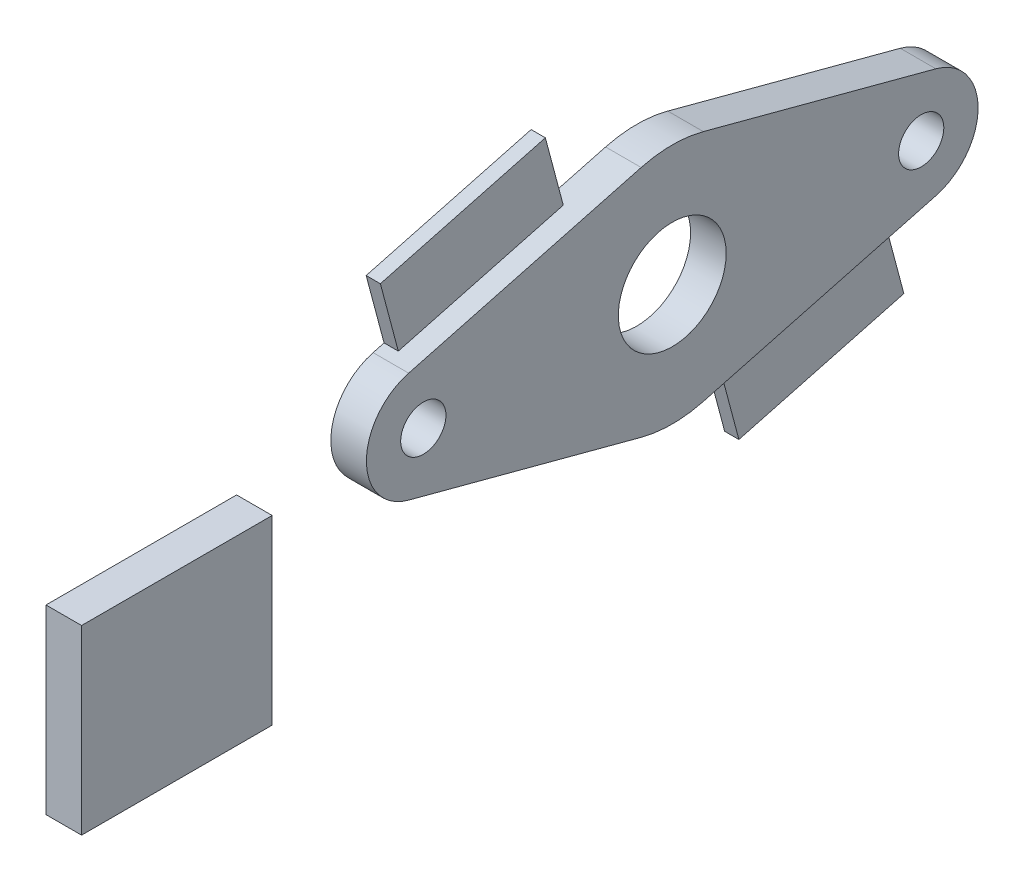
from build123d import *

# Parameters (mm, degrees)
SKETCH1_R           = 2.0193
SKETCH1_R_2         = 4.8133
BASE_FLANGE1_DEPTH  = 3.175
SKETCH2_W           = 17.015394269
SKETCH2_H           = 16.210936875
BOSS_EXTRUDE1_DEPTH = 3.175
BOSS_EXTRUDE2_DEPTH = 1.27


# Sheet-metal steps are written as plain solids
with BuildPart() as part:
    # Sketch1 → Base-Flange1 (new body)
    with BuildSketch(Plane(origin=(0, 0, 0), x_dir=(0, 0, -1), z_dir=(1, 0, 0))):
        with BuildLine():
            Line((-23.531285714, 4.909176879), (-2.775857143, 10.432000869))
            ThreePointArc((-2.775857143, 10.432000869), (0, 10.795), (2.775857143, 10.432000869))
            Line((2.775857143, 10.432000869), (23.531285714, 4.909176879))
            ThreePointArc((23.531285714, 4.909176879), (27.305, 0), (23.531285714, -4.909176879))
            Line((23.531285714, -4.909176879), (2.775857143, -10.432000869))
            ThreePointArc((2.775857143, -10.432000869), (0, -10.795), (-2.775857143, -10.432000869))
            Line((-2.775857143, -10.432000869), (-23.531285714, -4.909176879))
            ThreePointArc((-23.531285714, -4.909176879), (-27.305, 0), (-23.531285714, 4.909176879))
        make_face()
        with Locations((-22.225, 0)):
            Circle(SKETCH1_R, mode=Mode.SUBTRACT)
        with Locations((22.225, 0)):
            Circle(SKETCH1_R, mode=Mode.SUBTRACT)
        Circle(SKETCH1_R_2, mode=Mode.SUBTRACT)
    extrude(amount=-BASE_FLANGE1_DEPTH)

    # Sketch6 → Boss-Extrude2 (add)
    with BuildSketch(Plane.ZY.offset(3.175)):
        Polygon((-5.91907135, -9.595621183), (-20.646601988, -5.67676404), (-22.581830021, -12.949580859), (-7.854299383, -16.868438002), align=None)
        Polygon((7.823980768, 9.088742734), (22.551511406, 5.169885592), (24.150988111, 11.180909039), (9.423457473, 15.099766182), align=None)
    extrude(amount=-BOSS_EXTRUDE2_DEPTH)


with BuildPart() as body_2:
    # Sketch2 → Boss-Extrude1 (new body)
    with BuildSketch(Plane(origin=(0, 0, 0), x_dir=(0, 0, -1), z_dir=(1, 0, 0))):
        with Locations((-44.224918413, -8.105468438)):
            Rectangle(SKETCH2_W, SKETCH2_H)
    extrude(amount=-BOSS_EXTRUDE1_DEPTH)


solid = Compound([part.part, body_2.part])
